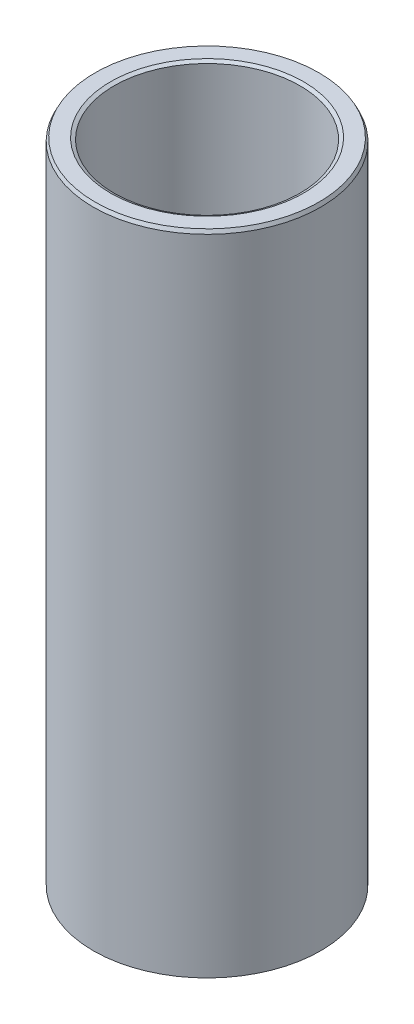
from build123d import *
from OCP.BRepFilletAPI import BRepFilletAPI_MakeChamfer

# Parameters (mm, degrees)
SKETCH1_R           = 37.5
BOSS_EXTRUDE1_DEPTH = 214.018456134
SKETCH2_R           = 30.669441164
CUT_EXTRUDE1_DEPTH  = 221.491268684
CHAMFER1_SIZE       = 1.154868637
CHAMFER1_SIZE2      = 0.584453352


with BuildPart() as part:
    # Sketch1 → Boss-Extrude1 (new body)
    with BuildSketch(Plane(origin=(0, 0, 0), x_dir=(1, 0, 0), z_dir=(0, 1, 0))):
        Circle(SKETCH1_R)
    extrude(amount=BOSS_EXTRUDE1_DEPTH)

    # Sketch2 → Cut-Extrude1 (cut, through all)
    with BuildSketch(Plane(origin=(0, 0, 0), x_dir=(1, 0, 0), z_dir=(0, 1, 0))):
        Circle(SKETCH2_R)
    extrude(amount=CUT_EXTRUDE1_DEPTH, mode=Mode.SUBTRACT)

    # Chamfer1: one chamfer whose edges measure the first distance from different faces: ONE call of the kernel's chamfer builder (chamfer() names one face for all edges)
    chamfer1_edges_1 = [part.edges().sort_by_distance(p)[0] for p in [
        (-30.669441164, 214.018456134, 0),
    ]]
    chamfer1_side_1 = [part.faces().sort_by_distance(p)[0] for p in [
        (-36.439339828, 214.018456134, 0),
    ]]
    chamfer1_edges_2 = [part.edges().sort_by_distance(p)[0] for p in [
        (-30.669441164, 0, 0),
    ]]
    chamfer1_side_2 = [part.faces().sort_by_distance(p)[0] for p in [
        (-30.669441164, 107.009228067, 0),
    ]]
    chamfer1_edges_3 = [part.edges().sort_by_distance(p)[0] for p in [
        (-37.5, 0, 0),
    ]]
    chamfer1_side_3 = [part.faces().sort_by_distance(p)[0] for p in [
        (-36.439339828, 0, 0),
    ]]
    chamfer1_edges_4 = [part.edges().sort_by_distance(p)[0] for p in [
        (-37.5, 214.018456134, 0),
    ]]
    chamfer1_side_4 = [part.faces().sort_by_distance(p)[0] for p in [
        (-37.5, 107.009228067, 0),
    ]]
    chamfer1 = BRepFilletAPI_MakeChamfer(part.part.solid().wrapped)
    for e in chamfer1_edges_1:
        chamfer1.Add(CHAMFER1_SIZE, CHAMFER1_SIZE2, e.wrapped, chamfer1_side_1[0].wrapped)  # the first distance lies on this face
    for e in chamfer1_edges_2:
        chamfer1.Add(CHAMFER1_SIZE, CHAMFER1_SIZE2, e.wrapped, chamfer1_side_2[0].wrapped)  # the first distance lies on this face
    for e in chamfer1_edges_3:
        chamfer1.Add(CHAMFER1_SIZE, CHAMFER1_SIZE2, e.wrapped, chamfer1_side_3[0].wrapped)  # the first distance lies on this face
    for e in chamfer1_edges_4:
        chamfer1.Add(CHAMFER1_SIZE, CHAMFER1_SIZE2, e.wrapped, chamfer1_side_4[0].wrapped)  # the first distance lies on this face
    add(Compound.cast(chamfer1.Shape()), mode=Mode.REPLACE)


solid = part.part
